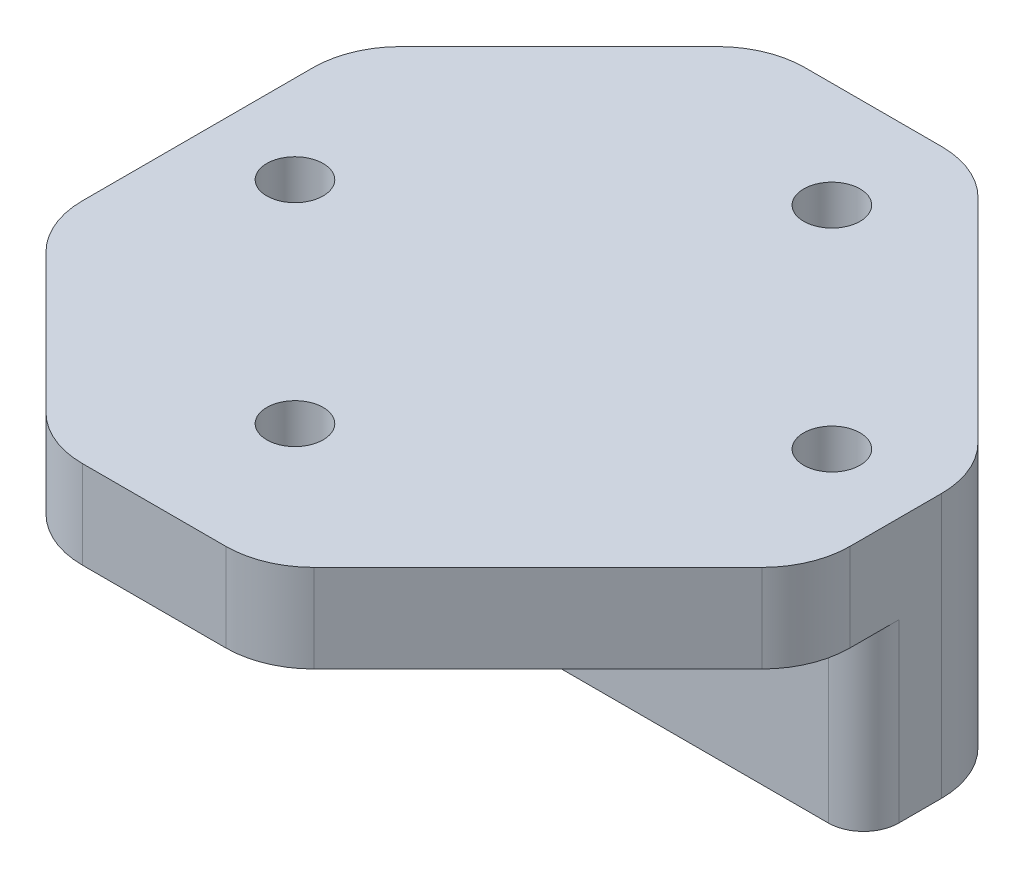
from build123d import *

# Parameters (mm, degrees)
SKETCH_1_R          = 1.6
EXTRUDE_1_DEPTH     = 5
EXTRUDE_START       = 10
SKETCH_2_R          = 1.6
EXTRUDE_2_DEPTH     = 10
SKETCH_3_OUTSIDE_W  = 52.342
SKETCH_3_OUTSIDE_H  = 53.542
CUT_EXTRUDE_1_DEPTH = 42.523968982
FILLET_1_R          = 5
FILLET_2_R          = 2
SKETCH_4_W          = 2.7
SKETCH_4_H          = 5.5
CUT_EXTRUDE_2_DEPTH = 53.191953403


with BuildPart() as part:
    # 草图1 → 凸台-拉伸1 (new body)
    with BuildSketch(Plane(origin=(0, 0, 0), x_dir=(1, 0, 0), z_dir=(0, 1, 0))):
        Polygon((6.8, 32), (21.8, 17), (21.8, -8), (-17, -8), (-17, 32), align=None)
        Circle(SKETCH_1_R, mode=Mode.SUBTRACT)
        with Locations((-12, 12)):
            Circle(SKETCH_1_R, mode=Mode.SUBTRACT)
        with Locations((4.5, 26)):
            Circle(SKETCH_1_R, mode=Mode.SUBTRACT)
        with Locations((16.5, 14)):
            Circle(SKETCH_1_R, mode=Mode.SUBTRACT)
    extrude(amount=EXTRUDE_1_DEPTH)

    # 草图2 → 凸台-拉伸2 (add)
    with BuildSketch(Plane.XZ.offset(EXTRUDE_START)):
        with BuildLine():
            Line((21.8, -10.5), (2, -10.5))
            ThreePointArc((2, -10.5), (0.585786438, -11.085786438), (0, -12.5))
            Line((0, -12.5), (0, -32))
            Line((0, -32), (6.8, -32))
            Line((6.8, -32), (21.8, -17))
            Line((21.8, -17), (21.8, -10.5))
        make_face()
        with Locations((4.5, -26)):
            Circle(SKETCH_2_R, mode=Mode.SUBTRACT)
        with Locations((16.5, -14)):
            Circle(SKETCH_2_R, mode=Mode.SUBTRACT)
    extrude(amount=-EXTRUDE_2_DEPTH)

    # 草图3 outside → 切除-拉伸1 (cut, through all)
    with BuildSketch(Plane(origin=(0, 5, 0), x_dir=(1, 0, 0), z_dir=(0, 1, 0))):
        with Locations((2.4, 12)):
            Rectangle(SKETCH_3_OUTSIDE_W, SKETCH_3_OUTSIDE_H)
        Polygon((-5.1, 32), (-17, 20.1), (-17, 2.857864376), (-6.142135624, -8), (6.142135624, -8), (21.8, 7.657864376), (21.8, 17), (6.8, 32), align=None, mode=Mode.SUBTRACT)
    extrude(amount=-CUT_EXTRUDE_1_DEPTH, mode=Mode.SUBTRACT)

    # 圆角1
    fillet_1_edges = [part.edges().sort_by_distance(p)[0] for p in [
        (21.8, 2.5, -7.657864376),
        (6.142135624, 2.5, 8),
        (-6.142135624, 2.5, 8),
        (-17, 2.5, -2.857864376),
        (-17, 2.5, -20.1),
        (-5.1, 2.5, -32),
        (21.8, -2.5, -17),
        (6.8, -2.5, -32),
    ]]
    fillet(fillet_1_edges, radius=FILLET_1_R)

    # 圆角2
    fillet_2_edges = [part.edges().sort_by_distance(p)[0] for p in [
        (0, -5, -32),
        (21.8, -5, -10.5),
    ]]
    fillet(fillet_2_edges, radius=FILLET_2_R)

    # 草图4 → 切除-拉伸2 (cut, through all)
    with BuildSketch(Plane(origin=(-10.2, 0, -32), x_dir=(1, 0, 0), z_dir=(0, 0, 1))):
        with Locations((11.55, -2.75)):
            Rectangle(SKETCH_4_W, SKETCH_4_H)
    extrude(amount=CUT_EXTRUDE_2_DEPTH, mode=Mode.SUBTRACT)


solid = part.part
